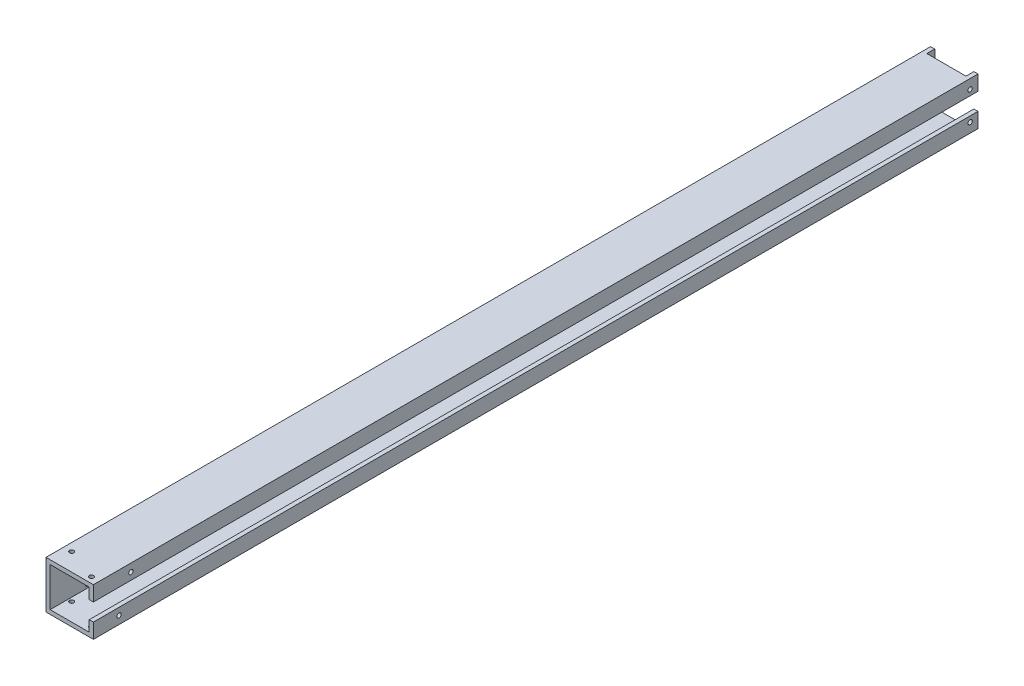
from build123d import *

# Parameters (mm, degrees)
BOSS_EXTRUDE1_DEPTH     = 711.2
CUT_EXTRUDE2_DEPTH      = 70.104
CUT_EXTRUDE2_DEPTH_BACK = 58.42
SKETCH7_R               = 1.75
SKETCH8_W               = 31.4325
SKETCH8_H               = 12.7
CUT_EXTRUDE3_DEPTH      = 71.882
SKETCH9_R               = 1.75
CUT_EXTRUDE4_DEPTH      = 68.326
SKETCH10_R              = 1.75
CUT_EXTRUDE5_DEPTH      = 12.7
CIRPATTERN1_COUNT       = 2


with BuildPart() as part:
    # Sketch1 → Boss-Extrude1 (new body)
    with BuildSketch(Plane(origin=(0, 0, 0), x_dir=(0, 1, 0), z_dir=(0, 0, 1))):
        Polygon((6.985, -19.05), (19.05, -19.05), (19.05, 19.05), (-19.05, 19.05), (-19.05, -19.05), (-6.985, -19.05), (-6.985, -15.71625), (-15.71625, -15.71625), (-15.71625, 15.71625), (15.71625, 15.71625), (15.71625, -15.71625), (6.985, -15.71625), align=None)
    extrude(amount=BOSS_EXTRUDE1_DEPTH)

    # Sketch7 → Cut-Extrude2 (cut, two sides: drawn at the far end of the back side and taken through both)
    with BuildSketch(Plane(origin=(0, 0, 0), x_dir=(-1, 0, 0), z_dir=(0, 1, 0)).offset(-CUT_EXTRUDE2_DEPTH_BACK)):
        with Locations((-12.7, 706.4375)):
            Circle(SKETCH7_R)
        with Locations((12.7, 696.9125)):
            Circle(SKETCH7_R)
    extrude(amount=CUT_EXTRUDE2_DEPTH + CUT_EXTRUDE2_DEPTH_BACK, mode=Mode.SUBTRACT)

    # Sketch8 → Cut-Extrude3 (cut)
    with BuildSketch(Plane(origin=(0, 19.05, 0), x_dir=(-1, 0, 0), z_dir=(0, 1, 0))):
        Rectangle(SKETCH8_W, SKETCH8_H)
    extrude(amount=-CUT_EXTRUDE3_DEPTH, mode=Mode.SUBTRACT)

    # Sketch9 → Cut-Extrude4 (cut)
    with BuildSketch(Plane.YZ.offset(19.05)):
        with Locations((-11.43, 6.35)):
            Circle(SKETCH9_R)
        with Locations((11.43, 6.35)):
            Circle(SKETCH9_R)
    extrude(amount=-CUT_EXTRUDE4_DEPTH, mode=Mode.SUBTRACT)

    # Sketch10 → Cut-Extrude5 (cut)
    with BuildSketch(Plane.YZ.offset(19.05)):
        with Locations((-12.7, 690.5625)):
            Circle(SKETCH10_R)
        with Locations((12.7, 681.0375)):
            Circle(SKETCH10_R)
    cut_extrude5 = extrude(amount=-CUT_EXTRUDE5_DEPTH, mode=Mode.SUBTRACT)

    # CirPattern1: Cut-Extrude5 ×2 about axis
    cirpattern1_axis = Axis((0, 0, 746.76), (0, 0, -1))
    for i in range(1, CIRPATTERN1_COUNT):
        add(cut_extrude5.rotate(cirpattern1_axis, i * 360 / CIRPATTERN1_COUNT), mode=Mode.SUBTRACT)


solid = part.part
